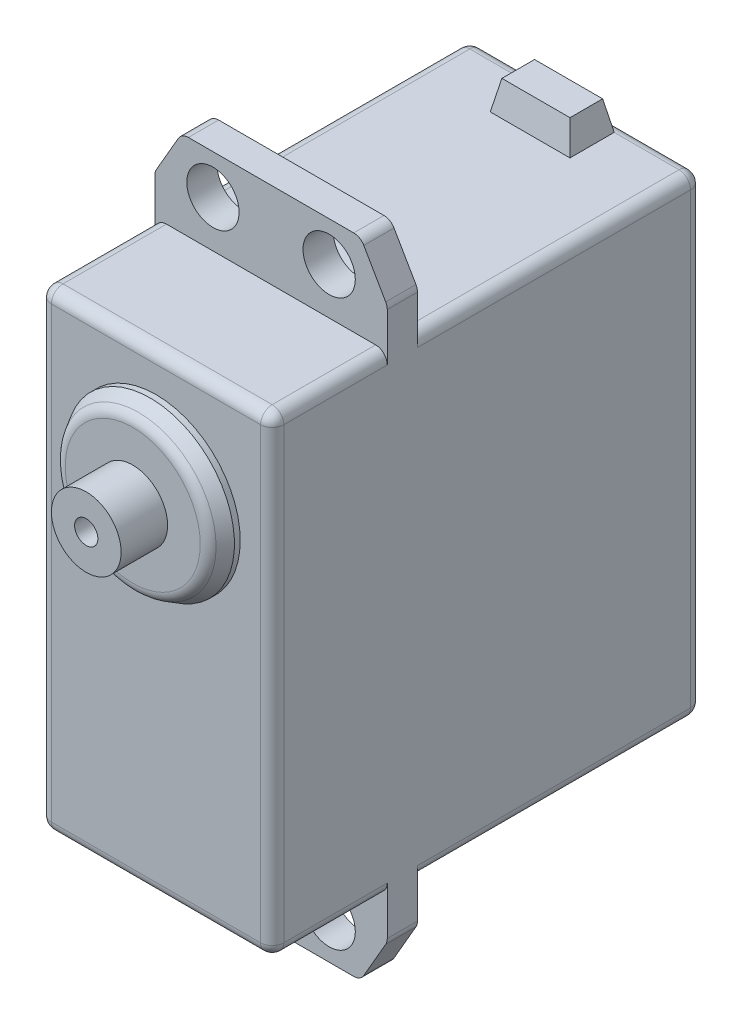
from build123d import *
from OCP.BRepFilletAPI import BRepFilletAPI_MakeChamfer

# Parameters (mm, degrees)
SKETCH3_W           = 20
SKETCH3_H           = 40.6
BOSS_EXTRUDE1_DEPTH = 37
SKETCH3_3_W         = 20
SKETCH3_3_H         = 7.4
SKETCH3_3_R         = 2.25
BOSS_EXTRUDE2_DEPTH = 12.5
SKETCH3_4_W         = 20
SKETCH3_4_H         = 7.4
SKETCH3_4_R         = 2.25
CUT_EXTRUDE1_DEPTH  = 9.9
SKETCH3_5_R         = 3
SKETCH3_5_R_2       = 1
BOSS_EXTRUDE3_DEPTH = 6
SKETCH3_6_R         = 7.25
SKETCH3_6_R_2       = 3
BOSS_EXTRUDE4_DEPTH = 2
CHAMFER1_SIZE       = 4
CHAMFER1_SIZE2      = 2.309401077
CHAMFER3_SIZE       = 1.5
CHAMFER3_SIZE2      = 0.866025404
FILLET2_R           = 1
SKETCH4_W           = 6.858
SKETCH4_H           = 3.81
BOSS_EXTRUDE6_DEPTH = 2.5
CHAMFER4_SIZE       = 2.5
CHAMFER4_SIZE_2     = 0.5


with BuildPart() as part:
    # Sketch3 → Boss-Extrude1 (new body)
    with BuildSketch(Plane.XY):
        Rectangle(SKETCH3_W, SKETCH3_H)
    extrude(amount=-BOSS_EXTRUDE1_DEPTH)

    # Sketch3<3> → Boss-Extrude2 (add)
    # profile 1 of 2: a face of its own
    with BuildSketch(Plane.XY):
        with Locations((0, 24)):
            Rectangle(SKETCH3_3_W, SKETCH3_3_H)
        with Locations((-5, 24.3)):
            Circle(SKETCH3_3_R, mode=Mode.SUBTRACT)
        with Locations((5, 24.3)):
            Circle(SKETCH3_3_R, mode=Mode.SUBTRACT)
    # profile 2 of 2: a face of its own
    with BuildSketch(Plane.XY):
        Polygon((10, -20.3), (-10, -20.3), (-10, -27.7), (0, -27.7), (10, -27.7), align=None)
        with Locations((-5, -24.3)):
            Circle(SKETCH3_3_R, mode=Mode.SUBTRACT)
        with Locations((5, -24.3)):
            Circle(SKETCH3_3_R, mode=Mode.SUBTRACT)
    extrude(amount=-BOSS_EXTRUDE2_DEPTH)

    # Sketch3<4> → Cut-Extrude1 (cut)
    # profile 1 of 2: a face of its own
    with BuildSketch(Plane.XY):
        with Locations((0, 24)):
            Rectangle(SKETCH3_4_W, SKETCH3_4_H)
        with Locations((-5, 24.3)):
            Circle(SKETCH3_4_R, mode=Mode.SUBTRACT)
        with Locations((5, 24.3)):
            Circle(SKETCH3_4_R, mode=Mode.SUBTRACT)
    # profile 2 of 2: a face of its own
    with BuildSketch(Plane.XY):
        Polygon((10, -20.3), (-10, -20.3), (-10, -27.7), (0, -27.7), (10, -27.7), align=None)
        with Locations((-5, -24.3)):
            Circle(SKETCH3_4_R, mode=Mode.SUBTRACT)
        with Locations((5, -24.3)):
            Circle(SKETCH3_4_R, mode=Mode.SUBTRACT)
    extrude(amount=-CUT_EXTRUDE1_DEPTH, mode=Mode.SUBTRACT)

    # Sketch3<5> → Boss-Extrude3 (add)
    with BuildSketch(Plane.XY):
        with Locations((0, 9.8)):
            Circle(SKETCH3_5_R)
        with Locations((0, 9.8)):
            Circle(SKETCH3_5_R_2, mode=Mode.SUBTRACT)
    extrude(amount=BOSS_EXTRUDE3_DEPTH)

    # Sketch3<6> → Boss-Extrude4 (add)
    with BuildSketch(Plane.XY):
        with Locations((0, 9.8)):
            Circle(SKETCH3_6_R)
        with Locations((0, 9.8)):
            Circle(SKETCH3_6_R_2, mode=Mode.SUBTRACT)
    extrude(amount=BOSS_EXTRUDE4_DEPTH)

    # Chamfer1: one chamfer whose edges measure the first distance from different faces: ONE call of the kernel's chamfer builder (chamfer() names one face for all edges)
    chamfer1_edges_1 = [part.edges().sort_by_distance(p)[0] for p in [
        (10, 27.7, -11.2),
        (10, -27.7, -11.2),
    ]]
    chamfer1_side_1 = [part.faces().sort_by_distance(p)[0] for p in [
        (10, 0, -18.317675312),
    ]]
    chamfer1_edges_2 = [part.edges().sort_by_distance(p)[0] for p in [
        (-10, 27.7, -11.2),
        (-10, -27.7, -11.2),
    ]]
    chamfer1_side_2 = [part.faces().sort_by_distance(p)[0] for p in [
        (-10, 0, -18.317675312),
    ]]
    chamfer1 = BRepFilletAPI_MakeChamfer(part.part.solid().wrapped)
    for e in chamfer1_edges_1:
        chamfer1.Add(CHAMFER1_SIZE, CHAMFER1_SIZE2, e.wrapped, chamfer1_side_1[0].wrapped)  # the first distance lies on this face
    for e in chamfer1_edges_2:
        chamfer1.Add(CHAMFER1_SIZE, CHAMFER1_SIZE2, e.wrapped, chamfer1_side_2[0].wrapped)  # the first distance lies on this face
    add(Compound.cast(chamfer1.Shape()), mode=Mode.REPLACE)

    # Chamfer3
    chamfer3_edges = [part.edges().sort_by_distance(p)[0] for p in [
        (-7.25, 9.8, 2),
    ]]
    chamfer3_side = [part.faces().sort_by_distance(p)[0] for p in [
        (-7.25, 9.8, 1),
    ]]
    chamfer(chamfer3_edges, length=CHAMFER3_SIZE, length2=CHAMFER3_SIZE2, reference=chamfer3_side[0])

    # Fillet2
    fillet2_edges = [part.edges().sort_by_distance(p)[0] for p in [
        (10, -20.3, -24.75),
        (-10, -20.3, -24.75),
        (-10, 20.3, -24.75),
        (10, 20.3, -24.75),
        (-7.690598923, -27.7, -11.2),
        (7.690598923, -27.7, -11.2),
        (0, 20.3, -37),
        (10, 23.7, -11.2),
        (10, -23.7, -11.2),
        (-10, 23.7, -11.2),
        (-10, -23.7, -11.2),
        (-7.690598923, 27.7, -11.2),
        (7.690598923, 27.7, -11.2),
        (-6.383974596, 9.8, 2),
        (-10, 0, -37),
        (0, -20.3, -37),
        (10, 0, -37),
        (10, 0, 0),
        (-10, 0, 0),
        (10, 20.3, -4.95),
        (-10, 20.3, -4.95),
        (0, 20.3, 0),
        (10, -20.3, -4.95),
        (0, -20.3, 0),
        (-10, -20.3, -4.95),
    ]]
    fillet(fillet2_edges, radius=FILLET2_R)

    # Sketch4 → Boss-Extrude6 (add)
    with BuildSketch(Plane(origin=(0, 20.3, 0), x_dir=(1, 0, 0), z_dir=(0, 1, 0))):
        with Locations((0, 34.095)):
            Rectangle(SKETCH4_W, SKETCH4_H)
    extrude(amount=BOSS_EXTRUDE6_DEPTH)

    # Chamfer4
    chamfer4_edges_1 = [part.edges().sort_by_distance(p)[0] for p in [
        (0, 22.8, -32.19),
    ]]
    chamfer4_side_1 = [part.faces().sort_by_distance(p)[0] for p in [
        (0, 22.79, -32.19),
    ]]
    chamfer4_edges_2 = [part.edges().sort_by_distance(p)[0] for p in [
        (-3.429, 22.8, -34.095),
    ]]
    chamfer4_side_2 = [part.faces().sort_by_distance(p)[0] for p in [
        (-3.429, 22.79, -34.095),
    ]]
    chamfer4_edges_3 = [part.edges().sort_by_distance(p)[0] for p in [
        (0, 22.8, -36),
    ]]
    chamfer4_side_3 = [part.faces().sort_by_distance(p)[0] for p in [
        (0, 22.79, -36),
    ]]
    chamfer4_edges_4 = [part.edges().sort_by_distance(p)[0] for p in [
        (3.429, 22.8, -34.095),
    ]]
    chamfer4_side_4 = [part.faces().sort_by_distance(p)[0] for p in [
        (3.429, 22.79, -34.095),
    ]]
    chamfer4 = BRepFilletAPI_MakeChamfer(part.part.solid().wrapped)
    for e in chamfer4_edges_1:
        chamfer4.Add(CHAMFER4_SIZE - 0.0001, CHAMFER4_SIZE_2 - 0.0001, e.wrapped, chamfer4_side_1[0].wrapped)
    for e in chamfer4_edges_2:
        chamfer4.Add(CHAMFER4_SIZE - 0.0001, CHAMFER4_SIZE_2 - 0.0001, e.wrapped, chamfer4_side_2[0].wrapped)
    for e in chamfer4_edges_3:
        chamfer4.Add(CHAMFER4_SIZE - 0.0001, CHAMFER4_SIZE_2 - 0.0001, e.wrapped, chamfer4_side_3[0].wrapped)
    for e in chamfer4_edges_4:
        chamfer4.Add(CHAMFER4_SIZE - 0.0001, CHAMFER4_SIZE_2 - 0.0001, e.wrapped, chamfer4_side_4[0].wrapped)
    add(Compound.cast(chamfer4.Shape()), mode=Mode.REPLACE)  # a hair under: the kernel refuses the full size


solid = part.part
